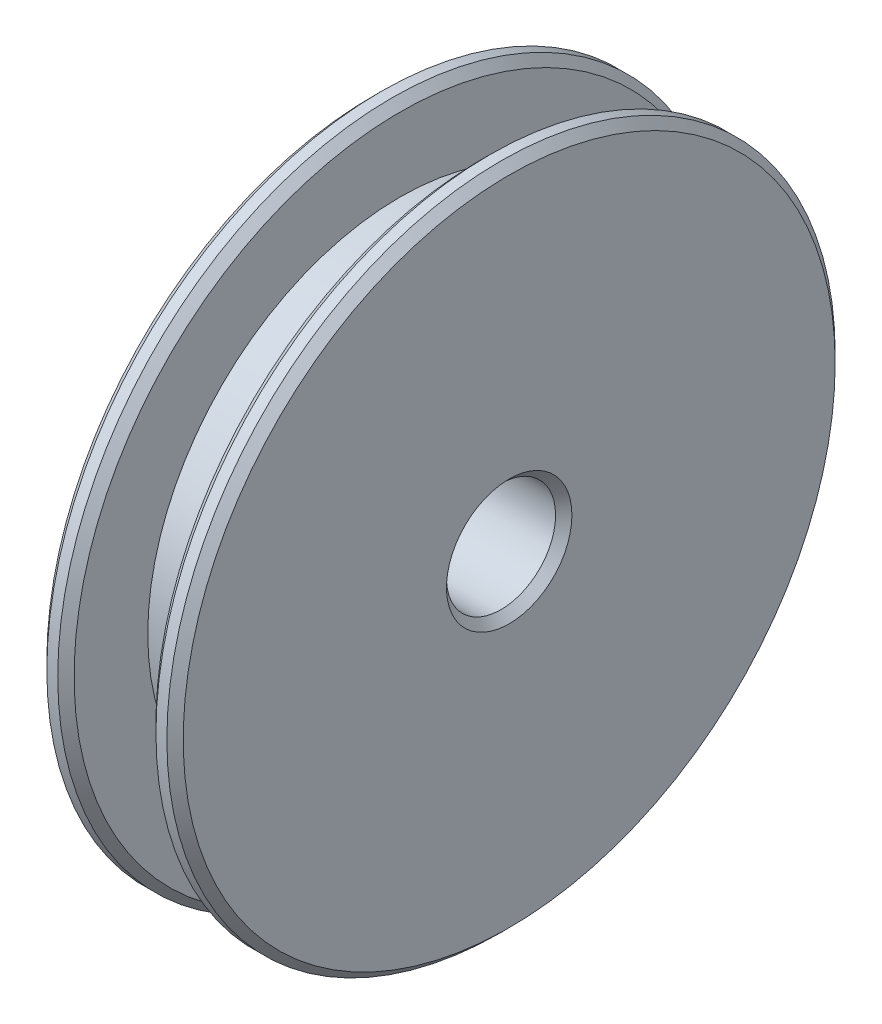
from build123d import *

# Parameters (mm, degrees)
SCHNITT_LINEAR_START                    = -20
SCHNITT_LINEAR_AUSTRAGEN1_OUTLINE_R     = 4.5
SCHNITT_LINEAR_AUSTRAGEN1_OUTLINE_R_2   = 2
SCHNITT_LINEAR_AUSTRAGEN1_DEPTH         = 6.199999898
SCHNITT_LINEAR_START_2                  = -12.199999898
SCHNITT_LINEAR_AUSTRAGEN1_2_OUTLINE_R   = 4.5
SCHNITT_LINEAR_AUSTRAGEN1_2_OUTLINE_R_2 = 2
SCHNITT_LINEAR_AUSTRAGEN1_2_DEPTH       = 6.199999898
SCHNITT_LINEAR_START_3                  = 6.199999898
SCHNITT_LINEAR_AUSTRAGEN1_3_OUTLINE_R   = 4.5
SCHNITT_LINEAR_AUSTRAGEN1_3_OUTLINE_R_2 = 2
SCHNITT_LINEAR_AUSTRAGEN1_3_DEPTH       = 1.600000204
SCHNITT_LINEAR_START_4                  = 1
SCHNITT_LINEAR_AUSTRAGEN1_4_OUTLINE_R   = 0.8
SCHNITT_LINEAR_AUSTRAGEN1_4_DEPTH       = 5
SKIZZE5_R                               = 0.85
SCHNITT_LINEAR_AUSTRAGEN2_DEPTH         = 30
SCHNITT_LINEAR_START_5                  = -4.5
SKIZZE6_R                               = 4.5
SCHNITT_LINEAR_AUSTRAGEN3_DEPTH         = 4.5
FASE1_SIZE                              = 0.3


with BuildPart() as part:
    # Schnitt-Linear austragen1: read off the stored shape, not the designer's step
    # Schnitt-Linear austragen1 outline → Schnitt-Linear austragen1 (new body)
    with BuildSketch(Plane(origin=(20, 0, 0), x_dir=(0, 0, -1), z_dir=(1, 0, 0)).offset(SCHNITT_LINEAR_START)):
        Circle(SCHNITT_LINEAR_AUSTRAGEN1_OUTLINE_R)
        Circle(SCHNITT_LINEAR_AUSTRAGEN1_OUTLINE_R_2, mode=Mode.SUBTRACT)
    extrude(amount=SCHNITT_LINEAR_AUSTRAGEN1_DEPTH)



with BuildPart() as body_2:
    # Schnitt-Linear austragen1 2 outline → Schnitt-Linear austragen1 2 (new body)
    with BuildSketch(Plane(origin=(20, 0, 0), x_dir=(0, 0, -1), z_dir=(1, 0, 0)).offset(SCHNITT_LINEAR_START_2)):
        Circle(SCHNITT_LINEAR_AUSTRAGEN1_2_OUTLINE_R)
        Circle(SCHNITT_LINEAR_AUSTRAGEN1_2_OUTLINE_R_2, mode=Mode.SUBTRACT)
    extrude(amount=SCHNITT_LINEAR_AUSTRAGEN1_2_DEPTH)


with BuildPart() as part_1:
    add(part.part)

    add(body_2.part)  # Schnitt-Linear austragen1 3 merges body 2
    # Schnitt-Linear austragen1 3 outline → Schnitt-Linear austragen1 3 (add)
    with BuildSketch(Plane.YZ.offset(SCHNITT_LINEAR_START_3)):
        Circle(SCHNITT_LINEAR_AUSTRAGEN1_3_OUTLINE_R)
        Circle(SCHNITT_LINEAR_AUSTRAGEN1_3_OUTLINE_R_2, mode=Mode.SUBTRACT)
    extrude(amount=SCHNITT_LINEAR_AUSTRAGEN1_3_DEPTH)

    # Schnitt-Linear austragen1 4 outline → Schnitt-Linear austragen1 4 (cut)
    with BuildSketch(Plane.XY.offset(SCHNITT_LINEAR_START_4)):
        with Locations((7, 0)):
            Circle(SCHNITT_LINEAR_AUSTRAGEN1_4_OUTLINE_R)
    extrude(amount=SCHNITT_LINEAR_AUSTRAGEN1_4_DEPTH, mode=Mode.SUBTRACT)

    # Skizze4 → Rotation1 (revolve)
    with BuildSketch(Plane(origin=(0, 0, 0), x_dir=(1, 0, 0), z_dir=(0, 1, 0))):
        Polygon((4.5, -4), (4.5, -12.25), (5.5, -12.25), (5.5, -9.25), (8.5, -9.25), (8.5, -12.25), (9.5, -12.25), (9.5, -4), align=None)
    revolve(axis=Axis((2.33899179, 0, 0), (1, 0, 0)))

    # Skizze5 → Schnitt-Linear austragen2 (cut)
    with BuildSketch(Plane.XY):
        with Locations(Location((7, 0, 0), (0, 0, 180))):
            Circle(SKIZZE5_R)
    extrude(amount=SCHNITT_LINEAR_AUSTRAGEN2_DEPTH, mode=Mode.SUBTRACT)

    # Skizze6 → Schnitt-Linear austragen3 (cut)
    with BuildSketch(Plane(origin=(14, 0, 0), x_dir=(0, 0, -1), z_dir=(1, 0, 0)).offset(SCHNITT_LINEAR_START_5)):
        with Locations(Location((0, 0, 0), (0, 0, 180))):
            Circle(SKIZZE6_R)
    extrude(amount=SCHNITT_LINEAR_AUSTRAGEN3_DEPTH, mode=Mode.SUBTRACT)

    # Fase1
    # the kernel refuses this chamfer: 0.3 mm, written as the material it takes off along each edge
    with BuildSketch(Plane(origin=(4.5, 0, 0), x_dir=(0, 0, 1), z_dir=(0, 1, 0))) as fase1_piece_1:
        Polygon((12.25 - FASE1_SIZE, 0), (12.25, FASE1_SIZE), (12.25, 0), align=None)
    revolve(axis=Axis((4.5, 0, 0), (1, 0, 0)), mode=Mode.SUBTRACT)
    with BuildSketch(Plane(origin=(5.5, 0, 0), x_dir=(0, 0, 1), z_dir=(0, 1, 0))) as fase1_piece_2:
        Polygon((12.25, -FASE1_SIZE), (12.25 - FASE1_SIZE, 0), (12.25, 0), align=None)
    revolve(axis=Axis((5.5, 0, 0), (1, 0, 0)), mode=Mode.SUBTRACT)
    with BuildSketch(Plane(origin=(8.5, 0, 0), x_dir=(0, 0, 1), z_dir=(0, 1, 0))) as fase1_piece_3:
        Polygon((12.25 - FASE1_SIZE, 0), (12.25, FASE1_SIZE), (12.25, 0), align=None)
    revolve(axis=Axis((8.5, 0, 0), (1, 0, 0)), mode=Mode.SUBTRACT)
    with BuildSketch(Plane(origin=(9.5, 0, 0), x_dir=(0, 0, 1), z_dir=(0, 1, 0))) as fase1_piece_4:
        Polygon((12.25, -FASE1_SIZE), (12.25 - FASE1_SIZE, 0), (12.25, 0), align=None)
    revolve(axis=Axis((9.5, 0, 0), (1, 0, 0)), mode=Mode.SUBTRACT)
    with BuildSketch(Plane(origin=(9.5, 0, 0), x_dir=(0, 0, -1), z_dir=(0, -1, 0))) as fase1_piece_5:
        Polygon((2 + FASE1_SIZE, 0), (2, -FASE1_SIZE), (2, 0), align=None)
    revolve(axis=Axis((9.5, 0, 0), (1, 0, 0)), mode=Mode.SUBTRACT)
    with BuildSketch(Plane(origin=(0, 0, 0), x_dir=(0, 0, -1), z_dir=(0, -1, 0))) as fase1_piece_6:
        Polygon((2, FASE1_SIZE), (2 + FASE1_SIZE, 0), (2, 0), align=None)
    revolve(axis=Axis((0, 0, 0), (1, 0, 0)), mode=Mode.SUBTRACT)
    with BuildSketch(Plane(origin=(0, 0, 0), x_dir=(0, 0, -1), z_dir=(0, -1, 0))) as fase1_piece_7:
        Polygon((4.5, FASE1_SIZE), (4.5 - FASE1_SIZE, 0), (4.5, 0), align=None)
    revolve(axis=Axis((0, 0, 0), (1, 0, 0)), mode=Mode.SUBTRACT)


solid = part_1.part
